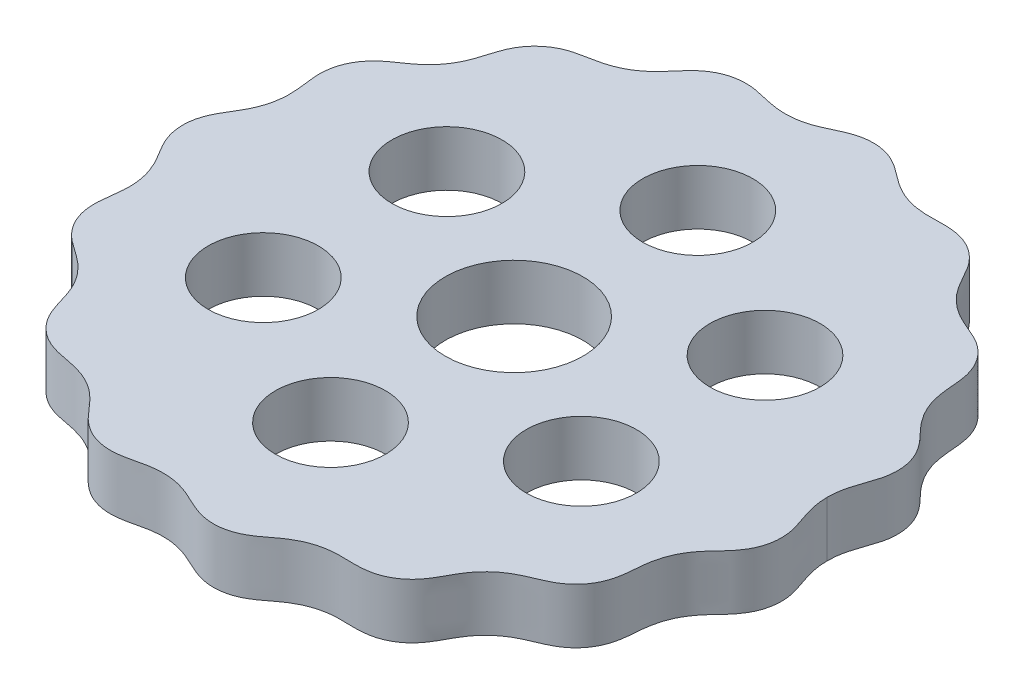
from build123d import *

# Parameters (mm, degrees)
BOSS_EXTRUDE1_DEPTH = 6
SKETCH4_R           = 7.5
SKETCH4_R_2         = 6
CUT_EXTRUDE1_DEPTH  = 52.524128715


# Read off the part's stored shape, not the designer's step: Boss-Extrude1
with BuildPart() as part:
    # Boss-Extrude1 outline → Boss-Extrude1 (new body)
    with BuildSketch(Plane(origin=(0, 0, 0), x_dir=(1, 0, 0), z_dir=(0, 1, 0))):
        with BuildLine():
            add(Edge.make_bspline(
                [(35.1, 0), (35.1, 0.590505396), (35.240363192, 1.775371445), (35.820649417, 3.460221883), (36.420258089, 5.182922693), (36.49009008, 7.036691576), (35.971525969, 8.81810695), (34.912641569, 10.330020301), (33.621599331, 11.583955703), (32.530885603, 12.995457989), (31.791093296, 14.622304809), (31.446470852, 16.372723238), (31.376680791, 18.1686138), (31.000088484, 19.972984436), (30.056960381, 21.570909376), (28.658612012, 22.790757694), (26.984853933, 23.523059012), (24.782993919, 24.424108104), (22.951045982, 26.01556046), (21.780036866, 28.084888281), (20.920896935, 29.689429895), (19.619265101, 31.010950046), (17.966242072, 31.852588599), (16.137450683, 32.117027744), (14.338213548, 31.998120627), (12.558392664, 32.106356528), (10.845986932, 32.618015832), (9.300164598, 33.510644828), (7.919095929, 34.654976802), (6.346983642, 35.613710053), (4.536489322, 36.020700739), (2.689597729, 35.838527493), (1.011679712, 35.10755743), (-0.59024614, 34.320588062), (-2.320031511, 33.872160035), (-4.107282277, 33.840128493), (-5.852149399, 34.199956298), (-7.611741565, 34.653786328), (-9.464894681, 34.611909176), (-11.2102625, 33.983192092), (-12.657382316, 32.831300342), (-13.779100061, 31.415159159), (-15.032179357, 30.147410677), (-16.543333034, 29.193120475), (-18.233328329, 28.616152041), (-20.003461322, 28.347939638), (-22.368834297, 27.695679441), (-24.244741717, 25.925157096), (-25.05435464, 23.616873799), (-25.527646496, 21.894741955), (-26.327202949, 20.296956392), (-27.47797565, 18.929439174), (-28.899041454, 17.854299825), (-30.419355917, 16.865457361), (-31.65855414, 15.488465409), (-32.395168258, 13.786086011), (-32.54818902, 11.941291578), (-32.254270976, 10.155180961), (-32.126229929, 8.377662558), (-32.400370125, 6.611494405), (-33.07761247, 4.958848649), (-34.053443295, 3.459440186), (-34.903560096, 1.834145338), (-35.1, 0.607115846), (-35.1, 0)],
                knots=[0.072369566, 0.072369566, 0.072369566, 0.072369566, 0.085664924, 0.098960282, 0.112255641, 0.125550999, 0.138846357, 0.152141715, 0.165437073, 0.178732431, 0.192027789, 0.205323147, 0.218618505, 0.231913863, 0.245209221, 0.25850458, 0.271799938, 0.285095296, 0.311686012, 0.32498137, 0.338276728, 0.351572086, 0.364867444, 0.378162802, 0.39145816, 0.404753519, 0.418048877, 0.431344235, 0.444639593, 0.457934951, 0.471230309, 0.484525667, 0.497821025, 0.511116383, 0.524411741, 0.5377071, 0.551002458, 0.564297816, 0.577593174, 0.590888532, 0.60418389, 0.617479248, 0.630774606, 0.644069964, 0.657365322, 0.67066068, 0.683956039, 0.710546755, 0.723842113, 0.737137471, 0.750432829, 0.763728187, 0.777023545, 0.790318903, 0.803614261, 0.816909619, 0.830204978, 0.843500336, 0.856795694, 0.870091052, 0.88338641, 0.896681768, 0.909977126, 0.923272484, 0.923272484, 0.923272484, 0.923272484], degree=3))
            add(Edge.make_bspline(
                [(-35.1, 0), (-35.1, -0.607115846), (-34.903560096, -1.834145338), (-34.053443295, -3.459440186), (-33.07761247, -4.958848649), (-32.400370125, -6.611494405), (-32.126229929, -8.377662558), (-32.254270976, -10.155180961), (-32.54818902, -11.941291578), (-32.395168257, -13.786086011), (-31.65855414, -15.488465409), (-30.419355917, -16.865457361), (-28.899041454, -17.854299825), (-27.477975649, -18.929439173), (-26.327202949, -20.296956392), (-25.527646496, -21.894741955), (-25.05435464, -23.616873799), (-24.244741717, -25.925157096), (-22.368834297, -27.695679441), (-20.003461322, -28.347939638), (-18.233328329, -28.61615204), (-16.543333033, -29.193120475), (-15.032179357, -30.147410677), (-13.779100061, -31.415159158), (-12.657382316, -32.831300342), (-11.2102625, -33.983192092), (-9.464894681, -34.611909176), (-7.611741565, -34.653786328), (-5.852149399, -34.199956298), (-4.107282277, -33.840128493), (-2.320031511, -33.872160035), (-0.590246139, -34.320588062), (1.011679712, -35.10755743), (2.689597729, -35.838527492), (4.536489323, -36.020700739), (6.346983642, -35.613710053), (7.919095929, -34.654976801), (9.300164598, -33.510644828), (10.845986933, -32.618015831), (12.558392664, -32.106356527), (14.338213548, -31.998120627), (16.137450683, -32.117027743), (17.966242072, -31.852588598), (19.619265101, -31.010950046), (20.920896935, -29.689429894), (21.780036867, -28.084888281), (22.951045982, -26.015560459), (24.782993919, -24.424108103), (26.984853933, -23.523059012), (28.658612012, -22.790757694), (30.056960381, -21.570909375), (31.000088484, -19.972984435), (31.376680791, -18.168613799), (31.446470852, -16.372723238), (31.791093296, -14.622304808), (32.530885603, -12.995457988), (33.621599331, -11.583955703), (34.912641569, -10.3300203), (35.971525969, -8.81810695), (36.49009008, -7.036691575), (36.420258089, -5.182922692), (35.820649417, -3.460221883), (35.240363192, -1.775371444), (35.1, -0.590505396), (35.1, 0)],
                knots=[0.072369566, 0.072369566, 0.072369566, 0.072369566, 0.085664924, 0.098960282, 0.112255641, 0.125550999, 0.138846357, 0.152141715, 0.165437073, 0.178732431, 0.192027789, 0.205323147, 0.218618505, 0.231913863, 0.245209221, 0.25850458, 0.271799938, 0.285095296, 0.311686012, 0.32498137, 0.338276728, 0.351572086, 0.364867444, 0.378162802, 0.39145816, 0.404753519, 0.418048877, 0.431344235, 0.444639593, 0.457934951, 0.471230309, 0.484525667, 0.497821025, 0.511116383, 0.524411741, 0.5377071, 0.551002458, 0.564297816, 0.577593174, 0.590888532, 0.60418389, 0.617479248, 0.630774606, 0.644069964, 0.657365322, 0.67066068, 0.683956039, 0.710546755, 0.723842113, 0.737137471, 0.750432829, 0.763728187, 0.777023545, 0.790318903, 0.803614261, 0.816909619, 0.830204978, 0.843500336, 0.856795694, 0.870091052, 0.88338641, 0.896681768, 0.909977126, 0.923272484, 0.923272484, 0.923272484, 0.923272484], degree=3))
        make_face()
    extrude(amount=BOSS_EXTRUDE1_DEPTH)

    # Sketch4 → Cut-Extrude1 (cut, through all)
    with BuildSketch(Plane(origin=(0, 6, 0), x_dir=(1, 0, 0), z_dir=(0, 1, 0))):
        with Locations(Location((1, 0, 0), (0, 0, 270))):
            Circle(SKETCH4_R)
        with Locations(Location((1, 20, 0), (0, 0, 270))):
            Circle(SKETCH4_R_2)
        with Locations(Location((18.320508076, 10, 0), (0, 0, 270))):
            Circle(SKETCH4_R_2)
        with Locations(Location((18.320508076, -10, 0), (0, 0, 270))):
            Circle(SKETCH4_R_2)
        with Locations(Location((1, -20, 0), (0, 0, 270))):
            Circle(SKETCH4_R_2)
        with Locations(Location((-16.320508076, -10, 0), (0, 0, 270))):
            Circle(SKETCH4_R_2)
        with Locations(Location((-16.320508076, 10, 0), (0, 0, 270))):
            Circle(SKETCH4_R_2)
    extrude(amount=-CUT_EXTRUDE1_DEPTH, mode=Mode.SUBTRACT)


solid = part.part
